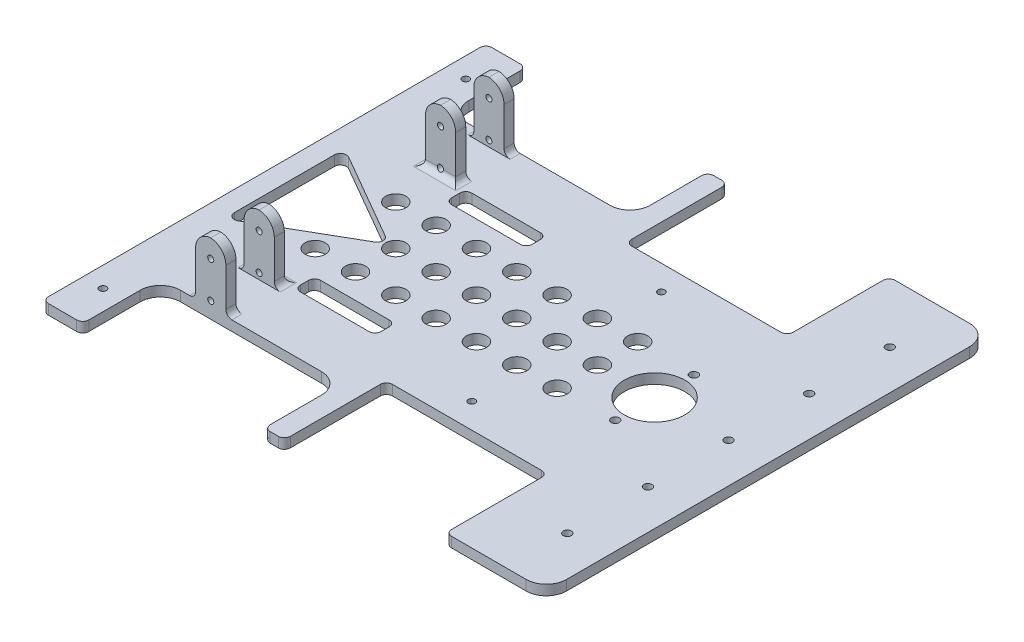
from build123d import *

# Parameters (mm, degrees)
SKETCH1_W            = 250
SKETCH1_H            = 220
BOSS_EXTRUDE1_DEPTH  = 2.5
SKETCH2_R            = 1.75
LINK_NAILS_DEPTH     = 2.5
SKETCH3_W            = 90
SKETCH3_H            = 38.497712582
CUT_EXTRUDE2_DEPTH   = 2.5
FILLET3_R            = 10
SKETCH4_R            = 15
SKETCH4_R_2          = 2
MIDDLE_HOLE_DEPTH    = 2.5
SKETCH6_R            = 2
CUT_EXTRUDE4_DEPTH   = 2.5
LPATTERN1_COUNT      = 3
LPATTERN1_PITCH      = 40
LPATTERN2_COUNT      = 3
LPATTERN2_PITCH      = 40
SKETCH8_W            = 15
SKETCH8_H            = 5
BOSS_EXTRUDE2_DEPTH  = 30
SKETCH10_W           = 40
SKETCH10_H           = 10
CUT_EXTRUDE6_DEPTH   = 33.75
CUT_EXTRUDE5_START   = -143.004575
SKETCH9_R            = 1.5
CUT_EXTRUDE5_DEPTH   = 143.004575
FILLET6_R            = 8
FILLET7_R            = 10
FILLET8_R            = 3
CUT_EXTRUDE7_DEPTH   = 5
FILLET9_R            = 3
FILLET10_R           = 3
SKETCH14_W           = 80
SKETCH14_H           = 50.633242795
CUT_EXTRUDE8_DEPTH   = 5
FILLET11_R           = 3
SKETCH15_R           = 5
CUT_EXTRUDE9_DEPTH   = 5
LPATTERN3_COUNT      = 7
LPATTERN3_PITCH      = 20
LPATTERN3_COUNT_DIR2 = 3
LPATTERN3_PITCH_DIR2 = 20


with BuildPart() as part:
    # Sketch1 → Boss-Extrude1 (new, symmetric)
    with BuildSketch(Plane(origin=(0, 0, 0), x_dir=(1, 0, 0), z_dir=(0, 1, 0))):
        Rectangle(SKETCH1_W, SKETCH1_H)
    extrude(amount=BOSS_EXTRUDE1_DEPTH, both=True)

    # Sketch2 → Link nails (cut, symmetric)
    with BuildSketch(Plane(origin=(0, 0, 0), x_dir=(1, 0, 0), z_dir=(0, 1, 0))):
        with Locations(Location((-115, 90, 0), (0, 0, 270))):
            Circle(SKETCH2_R)
        with Locations(Location((-115, -90, 0), (0, 0, 270))):
            Circle(SKETCH2_R)
        with Locations(Location((25, 47, 0), (0, 0, 270))):
            Circle(SKETCH2_R)
        with Locations(Location((25, -47, 0), (0, 0, 90))):
            Circle(SKETCH2_R)
    extrude(amount=LINK_NAILS_DEPTH, both=True, mode=Mode.SUBTRACT)

    # Sketch3 → Cut-Extrude2 (cut, symmetric)
    with BuildSketch(Plane(origin=(0, 0, 0), x_dir=(1, 0, 0), z_dir=(0, 1, 0))):
        with Locations((-60, 90.751143709)):
            Rectangle(SKETCH3_W, SKETCH3_H)
        with Locations((-60, -90.751143709)):
            Rectangle(SKETCH3_W, SKETCH3_H)
    extrude(amount=CUT_EXTRUDE2_DEPTH, both=True, mode=Mode.SUBTRACT)

    # Fillet3
    fillet3_edges = [part.edges().sort_by_distance(p)[0] for p in [
        (-15, 0, -71.502287418),
        (-105, 0, -71.502287418),
        (-105, 0, 71.502287418),
        (-15, 0, 71.502287418),
    ]]
    fillet(fillet3_edges, radius=FILLET3_R)

    # Sketch4 → middle hole (cut, symmetric)
    with BuildSketch(Plane(origin=(0, 0, 0), x_dir=(1, 0, 0), z_dir=(0, 1, 0))):
        with Locations(Location((68.657368821, 0, 0), (0, 0, 270))):
            Circle(SKETCH4_R)
        with Locations(Location((68.657368821, 19.5, 0), (0, 0, 270))):
            Circle(SKETCH4_R_2)
        with Locations(Location((68.657368821, -19.5, 0), (0, 0, 270))):
            Circle(SKETCH4_R_2)
    extrude(amount=MIDDLE_HOLE_DEPTH, both=True, mode=Mode.SUBTRACT)

    # Sketch6 → Cut-Extrude4 (cut, symmetric)
    with BuildSketch(Plane(origin=(0, 0, 0), x_dir=(1, 0, 0), z_dir=(0, 1, 0))):
        with Locations(Location((105.361166029, 0, 0), (0, 0, 270))):
            Circle(SKETCH6_R)
    cut_extrude4 = extrude(amount=CUT_EXTRUDE4_DEPTH, both=True, mode=Mode.SUBTRACT)

    # LPattern1: Cut-Extrude4 ×3
    with Locations(*[(0, 0, -i * LPATTERN1_PITCH) for i in range(1, LPATTERN1_COUNT)]):
        add(cut_extrude4, mode=Mode.SUBTRACT)

    # LPattern2: Cut-Extrude4 ×3
    with Locations(*[(0, 0, i * LPATTERN2_PITCH) for i in range(1, LPATTERN2_COUNT)]):
        add(cut_extrude4, mode=Mode.SUBTRACT)

    # Sketch8 → Boss-Extrude2 (add)
    with BuildSketch(Plane(origin=(0, 2.5, 0), x_dir=(1, 0, 0), z_dir=(0, 1, 0))):
        with Locations((-80, -69.002287418)):
            Rectangle(SKETCH8_W, SKETCH8_H)
        with Locations((-80, -45.002287418)):
            Rectangle(SKETCH8_W, SKETCH8_H)
        with Locations((-80, 45.002287418)):
            Rectangle(SKETCH8_W, SKETCH8_H)
        with Locations((-80, 69.002287418)):
            Rectangle(SKETCH8_W, SKETCH8_H)
    extrude(amount=BOSS_EXTRUDE2_DEPTH)

    # Sketch10 → Cut-Extrude6 (cut, symmetric)
    with BuildSketch(Plane(origin=(0, 0, 0), x_dir=(1, 0, 0), z_dir=(0, 1, 0))):
        with Locations((-47.5, -37.502287418)):
            Rectangle(SKETCH10_W, SKETCH10_H)
        with Locations((-47.5, 37.502287418)):
            Rectangle(SKETCH10_W, SKETCH10_H)
    extrude(amount=CUT_EXTRUDE6_DEPTH, both=True, mode=Mode.SUBTRACT)

    # Sketch9 → Cut-Extrude5 (cut)
    with BuildSketch(Plane.XY.offset(71.502287418).offset(CUT_EXTRUDE5_START)):
        with Locations((-80, 23.5)):
            Circle(SKETCH9_R)
        with Locations((-80, 5.5)):
            Circle(SKETCH9_R)
    extrude(amount=CUT_EXTRUDE5_DEPTH, mode=Mode.SUBTRACT)

    # Fillet6
    # the kernel refuses this fillet: 8 mm, written as the material it takes off along each edge
    with BuildSketch(Plane(origin=(-87.5, 32.5, 46.502287418), x_dir=(0, -1, 0), z_dir=(0, 0, 1)), Plane(origin=(-72.5, 32.5, 91.502287418), x_dir=(0, -1, 0), z_dir=(0, 0, -1)), Plane(origin=(-87.5, 32.5, -67.502287418), x_dir=(0, -1, 0), z_dir=(0, 0, 1)), Plane(origin=(-72.5, 32.5, -22.502287418), x_dir=(0, -1, 0), z_dir=(0, 0, -1))) as fillet6_piece_1:
        with BuildLine():
            CenterArc((FILLET6_R, FILLET6_R), FILLET6_R, 180, 90)
            Line((0, FILLET6_R), (0, 0))
            Line((0, 0), (FILLET6_R, 0))
        make_face()
    extrude(amount=45, mode=Mode.SUBTRACT)
    with BuildSketch(Plane(origin=(-72.5, 32.5, -91.502287418), x_dir=(0, -1, 0), z_dir=(0, 0, 1)), Plane(origin=(-87.5, 32.5, -46.502287418), x_dir=(0, -1, 0), z_dir=(0, 0, -1)), Plane(origin=(-72.5, 32.5, 22.502287418), x_dir=(0, -1, 0), z_dir=(0, 0, 1)), Plane(origin=(-87.5, 32.5, 67.502287418), x_dir=(0, -1, 0), z_dir=(0, 0, -1))) as fillet6_piece_2:
        with BuildLine():
            CenterArc((FILLET6_R, -FILLET6_R), FILLET6_R, 90, 90)
            Line((0, -FILLET6_R), (0, 0))
            Line((0, 0), (FILLET6_R, 0))
        make_face()
    extrude(amount=45, mode=Mode.SUBTRACT)

    # Fillet7
    fillet7_edges = [part.edges().sort_by_distance(p)[0] for p in [
        (125, 0, 110),
        (125, 0, -110),
    ]]
    fillet(fillet7_edges, radius=FILLET7_R)

    # Fillet8
    fillet8_edges = [part.edges().sort_by_distance(p)[0] for p in [
        (-67.5, 0, 42.502287418),
        (-67.5, 0, 32.502287418),
        (-27.5, 0, 32.502287418),
        (-27.5, 0, 42.502287418),
        (-27.5, 0, -32.502287418),
        (-67.5, 0, -32.502287418),
        (-67.5, 0, -42.502287418),
        (-27.5, 0, -42.502287418),
    ]]
    fillet(fillet8_edges, radius=FILLET8_R)

    # Sketch11 → Cut-Extrude7 (cut, symmetric)
    with BuildSketch(Plane(origin=(0, 0, 0), x_dir=(1, 0, 0), z_dir=(0, 1, 0))):
        Polygon((-63.038475773, 0), (-115, 30), (-115, -30), align=None)
    extrude(amount=CUT_EXTRUDE7_DEPTH, both=True, mode=Mode.SUBTRACT)

    # Fillet9
    fillet9_edges = [part.edges().sort_by_distance(p)[0] for p in [
        (-63.038475773, 0, 0),
        (-115, 0, 30),
        (-115, 0, -30),
    ]]
    fillet(fillet9_edges, radius=FILLET9_R)

    # Fillet10
    # the kernel refuses this fillet: 3 mm, written as the material it adds along each edge
    with BuildSketch(Plane(origin=(-87.5, 2.5, 66.502287418), x_dir=(-1, 0, 0), z_dir=(0, 0, 1)), Plane(origin=(-72.5, 2.5, 71.502287418), x_dir=(1, 0, 0), z_dir=(0, 0, -1)), Plane(origin=(-87.5, 2.5, -47.502287418), x_dir=(-1, 0, 0), z_dir=(0, 0, 1)), Plane(origin=(-72.5, 2.5, -42.502287418), x_dir=(1, 0, 0), z_dir=(0, 0, -1))) as fillet10_piece_1:
        with BuildLine():
            CenterArc((FILLET10_R, -FILLET10_R), FILLET10_R, 90, 90)
            Line((0, -FILLET10_R), (0, 0))
            Line((0, 0), (FILLET10_R, 0))
        make_face()
    extrude(amount=5)
    with BuildSketch(Plane(origin=(-87.5, 2.5, 42.502287418), x_dir=(0, 0, -1), z_dir=(1, 0, 0))) as fillet10_piece_2_section:
        with BuildLine():
            CenterArc((FILLET10_R, FILLET10_R), FILLET10_R, 180, 90)
            Line((0, FILLET10_R), (0, 0))
            Line((0, 0), (FILLET10_R, 0))
        make_face()
    fillet10_piece_2 = extrude(amount=15, mode=Mode.PRIVATE)
    fillet10_piece_2 = fillet10_piece_2 - Plane(origin=(-80, 5.5, 41.812790111), x_dir=(1, 0, 0), z_dir=(0, 0, -1)) * Cylinder(1.5, 43, mode=Mode.PRIVATE)
    add(fillet10_piece_2)
    with BuildSketch(Plane(origin=(-87.5, 2.5, 47.502287418), x_dir=(-1, 0, 0), z_dir=(0, 0, -1)), Plane(origin=(-72.5, 2.5, 42.502287418), x_dir=(1, 0, 0), z_dir=(0, 0, 1)), Plane(origin=(-87.5, 2.5, -66.502287418), x_dir=(-1, 0, 0), z_dir=(0, 0, -1)), Plane(origin=(-72.5, 2.5, -71.502287418), x_dir=(1, 0, 0), z_dir=(0, 0, 1))) as fillet10_piece_3:
        with BuildLine():
            CenterArc((FILLET10_R, FILLET10_R), FILLET10_R, 180, 90)
            Line((0, FILLET10_R), (0, 0))
            Line((0, 0), (FILLET10_R, 0))
        make_face()
    extrude(amount=5)
    with BuildSketch(Plane(origin=(-87.5, 2.5, -42.502287418), x_dir=(0, 0, 1), z_dir=(1, 0, 0))) as fillet10_piece_4_section:
        with BuildLine():
            CenterArc((FILLET10_R, -FILLET10_R), FILLET10_R, 90, 90)
            Line((0, -FILLET10_R), (0, 0))
            Line((0, 0), (FILLET10_R, 0))
        make_face()
    fillet10_piece_4 = extrude(amount=15, mode=Mode.PRIVATE)
    fillet10_piece_4 = fillet10_piece_4 - Plane(origin=(-80, 5.5, -41.812790112), x_dir=(1, 0, 0), z_dir=(0, 0, -1)) * Cylinder(1.5, 43, mode=Mode.PRIVATE)
    add(fillet10_piece_4)
    with BuildSketch(Plane(origin=(-95, 2.5, 42.502287418), x_dir=(0, 0, -1), z_dir=(1, 0, 0))) as fillet10_piece_5a_section:
        with BuildLine():
            CenterArc((FILLET10_R, FILLET10_R), FILLET10_R, 180, 90)
            Line((0, FILLET10_R), (0, 0))
            Line((0, 0), (FILLET10_R, 0))
        make_face()
    fillet10_piece_5a = extrude(amount=22.5, mode=Mode.PRIVATE)
    fillet10_piece_5a = split(fillet10_piece_5a, bisect_by=Plane(origin=(-87.5, 3.179185343, 41.823102075), z_dir=(-1, 0, 0)), keep=Keep.TOP, mode=Mode.PRIVATE)
    with BuildSketch(Plane(origin=(-87.5, 2.5, 47.502287418), x_dir=(-1, 0, 0), z_dir=(0, 0, -1))) as fillet10_piece_5b_section:
        with BuildLine():
            CenterArc((FILLET10_R, FILLET10_R), FILLET10_R, 180, 90)
            Line((0, FILLET10_R), (0, 0))
            Line((0, 0), (FILLET10_R, 0))
        make_face()
    fillet10_piece_5b = extrude(amount=12.5, mode=Mode.PRIVATE)
    fillet10_piece_5b = split(fillet10_piece_5b, bisect_by=Plane(origin=(-88.179185343, 3.179185343, 42.502287418), z_dir=(0, 0, -1)), keep=Keep.TOP, mode=Mode.PRIVATE)
    fillet10_piece_5 = fillet10_piece_5a & fillet10_piece_5b
    add(fillet10_piece_5)
    with BuildSketch(Plane(origin=(-72.5, 2.5, 35.002287418), x_dir=(1, 0, 0), z_dir=(0, 0, 1))) as fillet10_piece_6a_section:
        with BuildLine():
            CenterArc((FILLET10_R, FILLET10_R), FILLET10_R, 180, 90)
            Line((0, FILLET10_R), (0, 0))
            Line((0, 0), (FILLET10_R, 0))
        make_face()
    fillet10_piece_6a = extrude(amount=12.5, mode=Mode.PRIVATE)
    fillet10_piece_6a = split(fillet10_piece_6a, bisect_by=Plane(origin=(-71.820814657, 3.179185343, 42.502287418), z_dir=(0, 0, -1)), keep=Keep.TOP, mode=Mode.PRIVATE)
    with BuildSketch(Plane(origin=(-87.5, 2.5, 42.502287418), x_dir=(0, 0, -1), z_dir=(1, 0, 0))) as fillet10_piece_6b_section:
        with BuildLine():
            CenterArc((FILLET10_R, FILLET10_R), FILLET10_R, 180, 90)
            Line((0, FILLET10_R), (0, 0))
            Line((0, 0), (FILLET10_R, 0))
        make_face()
    fillet10_piece_6b = extrude(amount=22.5, mode=Mode.PRIVATE)
    fillet10_piece_6b = split(fillet10_piece_6b, bisect_by=Plane(origin=(-67.5, 3.179185343, 41.823102075), z_dir=(-1, 0, 0)), keep=Keep.TOP, mode=Mode.PRIVATE)
    fillet10_piece_6b = split(fillet10_piece_6b, bisect_by=Plane(origin=(-72.5, 3.179185343, 41.823102075), z_dir=(1, 0, 0)), keep=Keep.TOP, mode=Mode.PRIVATE)
    fillet10_piece_6 = fillet10_piece_6a & fillet10_piece_6b
    add(fillet10_piece_6)
    with BuildSketch(Plane(origin=(-87.5, 2.5, -47.502287418), x_dir=(-1, 0, 0), z_dir=(0, 0, 1))) as fillet10_piece_7a_section:
        with BuildLine():
            CenterArc((FILLET10_R, -FILLET10_R), FILLET10_R, 90, 90)
            Line((0, -FILLET10_R), (0, 0))
            Line((0, 0), (FILLET10_R, 0))
        make_face()
    fillet10_piece_7a = extrude(amount=12.5, mode=Mode.PRIVATE)
    fillet10_piece_7a = split(fillet10_piece_7a, bisect_by=Plane(origin=(-88.179185343, 3.179185343, -42.502287418), z_dir=(0, 0, 1)), keep=Keep.TOP, mode=Mode.PRIVATE)
    with BuildSketch(Plane(origin=(-95, 2.5, -42.502287418), x_dir=(0, 0, 1), z_dir=(1, 0, 0))) as fillet10_piece_7b_section:
        with BuildLine():
            CenterArc((FILLET10_R, -FILLET10_R), FILLET10_R, 90, 90)
            Line((0, -FILLET10_R), (0, 0))
            Line((0, 0), (FILLET10_R, 0))
        make_face()
    fillet10_piece_7b = extrude(amount=22.5, mode=Mode.PRIVATE)
    fillet10_piece_7b = split(fillet10_piece_7b, bisect_by=Plane(origin=(-87.5, 3.179185343, -41.823102075), z_dir=(-1, 0, 0)), keep=Keep.TOP, mode=Mode.PRIVATE)
    fillet10_piece_7 = fillet10_piece_7a & fillet10_piece_7b
    add(fillet10_piece_7)
    with BuildSketch(Plane(origin=(-87.5, 2.5, -42.502287418), x_dir=(0, 0, 1), z_dir=(1, 0, 0))) as fillet10_piece_8a_section:
        with BuildLine():
            CenterArc((FILLET10_R, -FILLET10_R), FILLET10_R, 90, 90)
            Line((0, -FILLET10_R), (0, 0))
            Line((0, 0), (FILLET10_R, 0))
        make_face()
    fillet10_piece_8a = extrude(amount=22.5, mode=Mode.PRIVATE)
    fillet10_piece_8a = split(fillet10_piece_8a, bisect_by=Plane(origin=(-67.5, 3.179185343, -41.823102075), z_dir=(-1, 0, 0)), keep=Keep.TOP, mode=Mode.PRIVATE)
    fillet10_piece_8a = split(fillet10_piece_8a, bisect_by=Plane(origin=(-72.5, 3.179185343, -41.823102075), z_dir=(1, 0, 0)), keep=Keep.TOP, mode=Mode.PRIVATE)
    with BuildSketch(Plane(origin=(-72.5, 2.5, -35.002287418), x_dir=(1, 0, 0), z_dir=(0, 0, -1))) as fillet10_piece_8b_section:
        with BuildLine():
            CenterArc((FILLET10_R, -FILLET10_R), FILLET10_R, 90, 90)
            Line((0, -FILLET10_R), (0, 0))
            Line((0, 0), (FILLET10_R, 0))
        make_face()
    fillet10_piece_8b = extrude(amount=12.5, mode=Mode.PRIVATE)
    fillet10_piece_8b = split(fillet10_piece_8b, bisect_by=Plane(origin=(-71.820814657, 3.179185343, -42.502287418), z_dir=(0, 0, 1)), keep=Keep.TOP, mode=Mode.PRIVATE)
    fillet10_piece_8 = fillet10_piece_8a & fillet10_piece_8b
    add(fillet10_piece_8)

    # Sketch14 → Cut-Extrude8 (cut, symmetric)
    with BuildSketch(Plane(origin=(0, 0, 0), x_dir=(1, 0, 0), z_dir=(0, 1, 0))):
        with Locations((35, -84.683378602)):
            Rectangle(SKETCH14_W, SKETCH14_H)
        with Locations((35, 84.683378602)):
            Rectangle(SKETCH14_W, SKETCH14_H)
    extrude(amount=CUT_EXTRUDE8_DEPTH, both=True, mode=Mode.SUBTRACT)

    # Fillet11
    fillet11_edges = [part.edges().sort_by_distance(p)[0] for p in [
        (-105, 0, -110),
        (-15, 0, -110),
        (-15, 0, 110),
        (-105, 0, 110),
        (75, 0, 110),
        (-5, 0, 110),
        (-5, 0, 59.366757205),
        (75, 0, 59.366757205),
        (-5, 0, -59.366757205),
        (-5, 0, -110),
        (75, 0, -110),
        (75, 0, -59.366757205),
        (-125, 0, 110),
        (-125, 0, -110),
    ]]
    fillet(fillet11_edges, radius=FILLET11_R)

    # Sketch15 → Cut-Extrude9 (cut, symmetric)
    with BuildSketch(Plane(origin=(0, 0, 0), x_dir=(1, 0, 0), z_dir=(0, 1, 0))):
        with Locations(Location((40.498252977, 19.803847577, 0), (0, 0, 270))):
            Circle(SKETCH15_R)
    cut_extrude9 = extrude(amount=CUT_EXTRUDE9_DEPTH, both=True, mode=Mode.SUBTRACT)

    # LPattern3: Cut-Extrude9 7 × 3
    with Locations(*[(-i * LPATTERN3_PITCH, 0, j * LPATTERN3_PITCH_DIR2) for i in range(LPATTERN3_COUNT) for j in range(LPATTERN3_COUNT_DIR2) if (i, j) != (0, 0)]):
        add(cut_extrude9, mode=Mode.SUBTRACT)


solid = part.part
